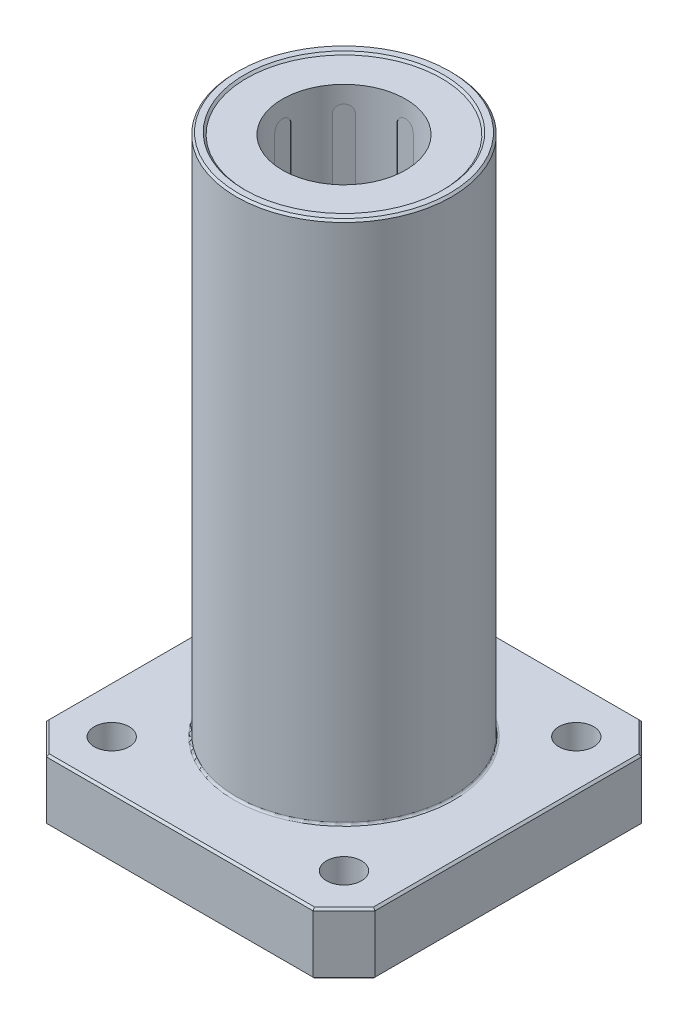
from build123d import *

# Parameters (mm, degrees)
SKETCH1_W                                        = 32
SKETCH1_H                                        = 32
BOSS_EXTRUDE1_DEPTH                              = 6
CHAMFER1_SIZE                                    = 3
SKETCH2_R                                        = 10.5
BOSS_EXTRUDE2_DEPTH                              = 51
SKETCH3_R                                        = 6
CUT_EXTRUDE1_DEPTH                               = 62.326992426
SKETCH4_R                                        = 9.5
SKETCH4_R_2                                      = 6
CUT_EXTRUDE2_DEPTH                               = 0.2
CUT_EXTRUDE3_START                               = -0.2
SKETCH5_R                                        = 9.5
SKETCH5_R_2                                      = 6
CUT_EXTRUDE3_DEPTH                               = 0.2
CHAMFER2_SIZE                                    = 0.2
CBORE_FOR_M3_PAN_HEAD_MACHINE_SCREW1_D           = 3.4
CBORE_FOR_M3_PAN_HEAD_MACHINE_SCREW1_CBORE_D     = 7
CBORE_FOR_M3_PAN_HEAD_MACHINE_SCREW1_CBORE_DEPTH = 2.4
CUT_EXTRUDE5_DEPTH                               = 6
CIRPATTERN1_START                                = 5.946427399
CIRPATTERN1_DEPTH                                = 0.053572601
CIRPATTERN1_START_2                              = -6
CIRPATTERN1_2_DEPTH                              = 12
CIRPATTERN1_3_DEPTH                              = 12
CIRPATTERN1_4_DEPTH                              = 12
FILLET2_R                                        = 0.2


# Read off the part's stored shape, not the designer's step: CirPattern1
with BuildPart() as part:
    # Sketch1 → Boss-Extrude1 (new body)
    with BuildSketch(Plane(origin=(0, 0, 0), x_dir=(1, 0, 0), z_dir=(0, 1, 0))):
        Rectangle(SKETCH1_W, SKETCH1_H)
    extrude(amount=BOSS_EXTRUDE1_DEPTH)

    # Chamfer1
    chamfer1_edges = [part.edges().sort_by_distance(p)[0] for p in [
        (16, 3, 16),
        (-16, 3, 16),
        (-16, 3, -16),
        (16, 3, -16),
    ]]
    chamfer(chamfer1_edges, length=CHAMFER1_SIZE)

    # Sketch2 → Boss-Extrude2 (add)
    with BuildSketch(Plane(origin=(0, 6, 0), x_dir=(1, 0, 0), z_dir=(0, 1, 0))):
        with Locations(Location((0, 0, 0), (0, 0, 270))):
            Circle(SKETCH2_R)
    extrude(amount=BOSS_EXTRUDE2_DEPTH)

    # Sketch3 → Cut-Extrude1 (cut, through all)
    with BuildSketch(Plane(origin=(0, 57, 0), x_dir=(1, 0, 0), z_dir=(0, 1, 0))):
        with Locations(Location((0, 0, 0), (0, 0, 270))):
            Circle(SKETCH3_R)
    extrude(amount=-CUT_EXTRUDE1_DEPTH, mode=Mode.SUBTRACT)

    # Sketch4 → Cut-Extrude2 (cut)
    with BuildSketch(Plane(origin=(0, 57, 0), x_dir=(1, 0, 0), z_dir=(0, 1, 0))):
        with Locations(Location((0, 0, 0), (0, 0, 270))):
            Circle(SKETCH4_R)
        with Locations(Location((0, 0, 0), (0, 0, 270))):
            Circle(SKETCH4_R_2, mode=Mode.SUBTRACT)
    extrude(amount=-CUT_EXTRUDE2_DEPTH, mode=Mode.SUBTRACT)

    # Sketch5 → Cut-Extrude3 (cut)
    with BuildSketch(Plane.XZ.offset(CUT_EXTRUDE3_START)):
        with Locations(Location((0, 0, 0), (0, 0, 90))):
            Circle(SKETCH5_R)
        with Locations(Location((0, 0, 0), (0, 0, 90))):
            Circle(SKETCH5_R_2, mode=Mode.SUBTRACT)
    extrude(amount=CUT_EXTRUDE3_DEPTH, mode=Mode.SUBTRACT)

    # Chamfer2
    chamfer2_edges = [part.edges().sort_by_distance(p)[0] for p in [
        (0, 0, -16),
        (0, 6, -16),
        (16, 0, 0),
        (0, 0, 16),
        (-16, 0, 0),
        (-14.5, 0, 14.5),
        (-14.5, 0, -14.5),
        (14.5, 0, 14.5),
        (14.5, 0, -14.5),
        (16, 6, 0),
        (-16, 6, 0),
        (0, 6, 16),
        (-14.5, 6, 14.5),
        (-14.5, 6, -14.5),
        (14.5, 6, 14.5),
        (14.5, 6, -14.5),
        (0, 57, -10.5),
        (0, 57, -9.5),
        (0, 0, -9.5),
    ]]
    chamfer(chamfer2_edges, length=CHAMFER2_SIZE - 0.0001)  # a hair under: the kernel refuses the full size

    # CBORE for M3 Pan Head Machine Screw1 (through all)
    with Locations(Plane(origin=(0, 0, 0), x_dir=(-1, 0, 0), z_dir=(0, -1, 0))):
        with Locations((11.313708499, -11.313708499), (-11.313708499, -11.313708499), (-11.313708499, 11.313708499), (11.313708499, 11.313708499)):
            CounterBoreHole(CBORE_FOR_M3_PAN_HEAD_MACHINE_SCREW1_D / 2, CBORE_FOR_M3_PAN_HEAD_MACHINE_SCREW1_CBORE_D / 2, CBORE_FOR_M3_PAN_HEAD_MACHINE_SCREW1_CBORE_DEPTH)

    # Sketch10 → Cut-Extrude5 (cut)
    with BuildSketch(Plane.XY):
        with BuildLine():
            Line((0.8, 54.341250921), (0.8, 7.019103432))
            ThreePointArc((0.8, 7.019103432), (0, 6.219103432), (-0.8, 7.019103432))
            Line((-0.8, 7.019103432), (-0.8, 54.341250921))
            ThreePointArc((-0.8, 54.341250921), (0, 55.141250921), (0.8, 54.341250921))
        make_face()
    extrude(amount=-CUT_EXTRUDE5_DEPTH, mode=Mode.SUBTRACT)

    # CirPattern1 outline → CirPattern1 (cut)
    with BuildSketch(Plane.XY.offset(CIRPATTERN1_START)):
        with BuildLine():
            ThreePointArc((0.8, 54.341250921), (0.565685425, 54.906936346), (0, 55.141250921))
            ThreePointArc((0, 55.141250921), (-0.565685425, 54.906936346), (-0.8, 54.341250921))
            Line((-0.8, 54.341250921), (-0.8, 7.019103432))
            ThreePointArc((-0.8, 7.019103432), (-0.565685425, 6.453418007), (0, 6.219103432))
            ThreePointArc((0, 6.219103432), (0.565685425, 6.453418007), (0.8, 7.019103432))
            Line((0.8, 7.019103432), (0.8, 54.341250921))
        make_face()
    extrude(amount=CIRPATTERN1_DEPTH, mode=Mode.SUBTRACT)

    # CirPattern1 2 outline → CirPattern1 2 (cut)
    with BuildSketch(Plane(origin=(0, 0, 0), x_dir=(0.707106781186556, 0, 0.707106781186539), z_dir=(0.707106781186539, 0, -0.707106781186556)).offset(CIRPATTERN1_START_2)):
        with BuildLine():
            ThreePointArc((0, -6.219103432), (-0.565685425, -6.453418007), (-0.8, -7.019103432))
            Line((-0.8, -7.019103432), (-0.8, -54.341250921))
            ThreePointArc((-0.8, -54.341250921), (-0.565685425, -54.906936346), (0, -55.141250921))
            ThreePointArc((0, -55.141250921), (0.565685425, -54.906936346), (0.8, -54.341250921))
            Line((0.8, -54.341250921), (0.8, -7.019103432))
            ThreePointArc((0.8, -7.019103432), (0.565685425, -6.453418007), (0, -6.219103432))
        make_face()
    extrude(amount=CIRPATTERN1_2_DEPTH, mode=Mode.SUBTRACT)

    # CirPattern1 3 outline → CirPattern1 3 (cut)
    with BuildSketch(Plane.YZ.offset(CIRPATTERN1_START_2)):
        with BuildLine():
            ThreePointArc((6.219103432, 0), (6.453418007, -0.565685425), (7.019103432, -0.8))
            Line((7.019103432, -0.8), (54.341250921, -0.8))
            ThreePointArc((54.341250921, -0.8), (54.906936346, -0.565685425), (55.141250921, 0))
            ThreePointArc((55.141250921, 0), (54.906936346, 0.565685425), (54.341250921, 0.8))
            Line((54.341250921, 0.8), (7.019103432, 0.8))
            ThreePointArc((7.019103432, 0.8), (6.453418007, 0.565685425), (6.219103432, 0))
        make_face()
    extrude(amount=CIRPATTERN1_3_DEPTH, mode=Mode.SUBTRACT)

    # CirPattern1 4 outline → CirPattern1 4 (cut)
    with BuildSketch(Plane(origin=(0, 0, 0), x_dir=(0.707106781186541, 0, -0.707106781186554), z_dir=(0.707106781186554, 0, 0.707106781186541)).offset(CIRPATTERN1_START_2)):
        with BuildLine():
            ThreePointArc((0, 6.219103432), (0.565685425, 6.453418007), (0.8, 7.019103432))
            Line((0.8, 7.019103432), (0.8, 54.341250921))
            ThreePointArc((0.8, 54.341250921), (0.565685425, 54.906936346), (0, 55.141250921))
            ThreePointArc((0, 55.141250921), (-0.565685425, 54.906936346), (-0.8, 54.341250921))
            Line((-0.8, 54.341250921), (-0.8, 7.019103432))
            ThreePointArc((-0.8, 7.019103432), (-0.565685425, 6.453418007), (0, 6.219103432))
        make_face()
    extrude(amount=CIRPATTERN1_4_DEPTH, mode=Mode.SUBTRACT)

    # Fillet2
    fillet2_edges = [part.edges().sort_by_distance(p)[0] for p in [
        (0, 6, -10.5),
    ]]
    fillet(fillet2_edges, radius=FILLET2_R)


solid = part.part
